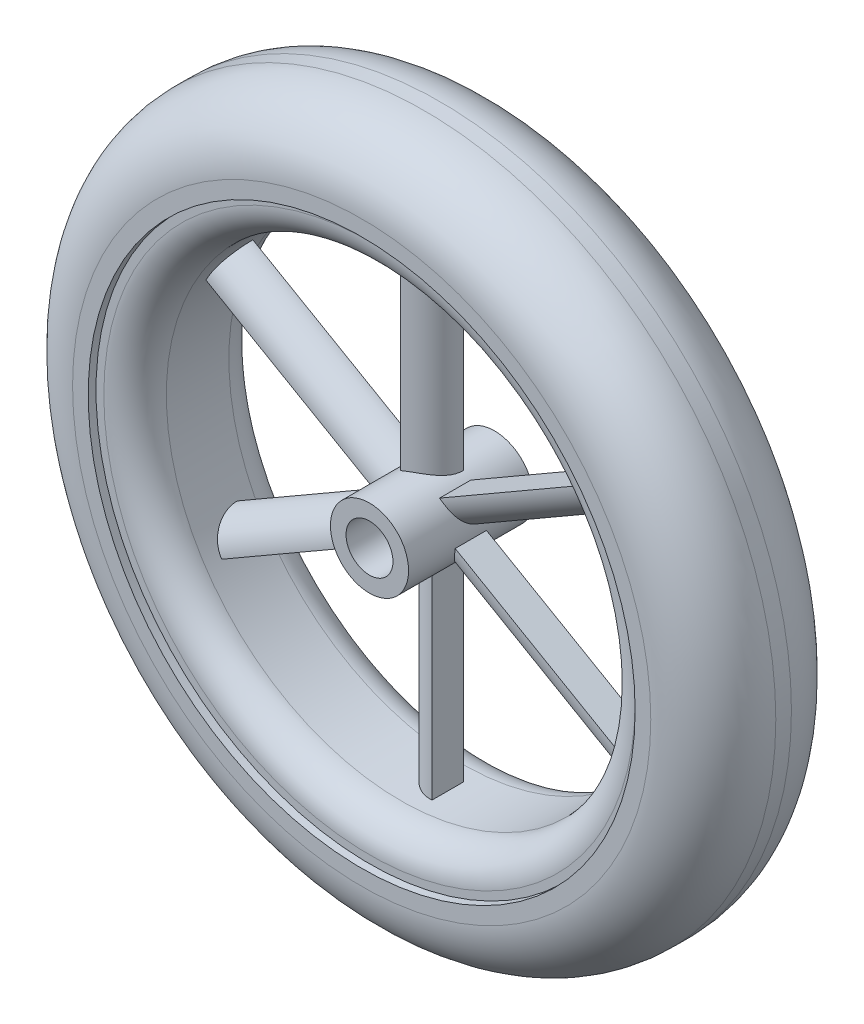
from build123d import *

# Parameters (mm, degrees)
SKETCH1_R           = 2.5
SKETCH1_R_2         = 1.5
BOSS_EXTRUDE1_DEPTH = 4
SKETCH2_R           = 17.5
SKETCH2_R_2         = 15
BOSS_EXTRUDE2_DEPTH = 4
BOSS_EXTRUDE5_DEPTH = 1
FILLET1_R           = 2
FILLET2_R           = 2
SKETCH4_R           = 22.5
SKETCH4_R_2         = 17.5
BOSS_EXTRUDE6_DEPTH = 4.5
FILLET3_R           = 4


with BuildPart() as part:
    # Sketch1 → Boss-Extrude1 (new, symmetric)
    with BuildSketch(Plane.XY):
        Circle(SKETCH1_R)
        Circle(SKETCH1_R_2, mode=Mode.SUBTRACT)
    extrude(amount=BOSS_EXTRUDE1_DEPTH, both=True)



with BuildPart() as body_2:
    # Sketch2 → Boss-Extrude2 (new, symmetric)
    with BuildSketch(Plane.XY):
        Circle(SKETCH2_R)
        Circle(SKETCH2_R_2, mode=Mode.SUBTRACT)
    extrude(amount=BOSS_EXTRUDE2_DEPTH, both=True)


with BuildPart() as part_1:
    add(part.part)

    add(body_2.part)  # Boss-Extrude5 merges body 2
    # Sketch3 → Boss-Extrude5 (add, symmetric)
    with BuildSketch(Plane.XY):
        with BuildLine():
            Line((-1, 2.291287847), (-1, 14.966629547))
            ThreePointArc((-1, 14.966629547), (0, 15), (1, 14.966629547))
            Line((1, 14.966629547), (1, 2.291287847))
            ThreePointArc((1, 2.291287847), (0, 2.5), (-1, 2.291287847))
        make_face()
        with BuildLine():
            Line((1.484313483, 2.011669328), (12.461481397, 8.349340177))
            ThreePointArc((12.461481397, 8.349340177), (12.990381057, 7.5), (13.461481397, 6.61728937))
            Line((13.461481397, 6.61728937), (2.484313483, 0.27961852))
            ThreePointArc((2.484313483, 0.27961852), (2.165063509, 1.25), (1.484313483, 2.011669328))
        make_face()
        with BuildLine():
            Line((2.484313483, -0.27961852), (13.461481397, -6.61728937))
            ThreePointArc((13.461481397, -6.61728937), (12.990381057, -7.5), (12.461481397, -8.349340177))
            Line((12.461481397, -8.349340177), (1.484313483, -2.011669328))
            ThreePointArc((1.484313483, -2.011669328), (2.165063509, -1.25), (2.484313483, -0.27961852))
        make_face()
        with BuildLine():
            Line((1, -2.291287847), (1, -14.966629547))
            ThreePointArc((1, -14.966629547), (0, -15), (-1, -14.966629547))
            Line((-1, -14.966629547), (-1, -2.291287847))
            ThreePointArc((-1, -2.291287847), (0, -2.5), (1, -2.291287847))
        make_face()
        with BuildLine():
            Line((-1.484313483, -2.011669328), (-12.461481397, -8.349340177))
            ThreePointArc((-12.461481397, -8.349340177), (-12.990381057, -7.5), (-13.461481397, -6.61728937))
            Line((-13.461481397, -6.61728937), (-2.484313483, -0.27961852))
            ThreePointArc((-2.484313483, -0.27961852), (-2.165063509, -1.25), (-1.484313483, -2.011669328))
        make_face()
        with BuildLine():
            Line((-2.484313483, 0.27961852), (-13.461481397, 6.61728937))
            ThreePointArc((-13.461481397, 6.61728937), (-12.990381057, 7.5), (-12.461481397, 8.349340177))
            Line((-12.461481397, 8.349340177), (-1.484313483, 2.011669328))
            ThreePointArc((-1.484313483, 2.011669328), (-2.165063509, 1.25), (-2.484313483, 0.27961852))
        make_face()
    extrude(amount=BOSS_EXTRUDE5_DEPTH, both=True)

    # Fillet1
    fillet1_edges = [part_1.edges().sort_by_distance(p)[0] for p in [
        (-15, 0, -4),
        (-15, 0, 4),
    ]]
    fillet(fillet1_edges, radius=FILLET1_R)

    # Fillet2
    fillet2_edges = [part_1.edges().sort_by_distance(p)[0] for p in [
        (-1, -8.628958697, 1),
        (6.97289744, -5.180504752, 1),
        (7.97289744, 3.448453945, 1),
        (1, 8.628958697, 1),
        (-6.97289744, 5.180504752, 1),
        (-7.97289744, -3.448453945, 1),
    ]]
    fillet(fillet2_edges, radius=FILLET2_R - 0.0001)  # a hair under: the kernel refuses the full size

    # Sketch4 → Boss-Extrude6 (add, symmetric)
    with BuildSketch(Plane.XY):
        Circle(SKETCH4_R)
        Circle(SKETCH4_R_2, mode=Mode.SUBTRACT)
    extrude(amount=BOSS_EXTRUDE6_DEPTH, both=True)

    # Fillet3
    fillet3_edges = [part_1.edges().sort_by_distance(p)[0] for p in [
        (-22.5, 0, 4.5),
        (-22.5, 0, -4.5),
    ]]
    fillet(fillet3_edges, radius=FILLET3_R)


solid = part_1.part
